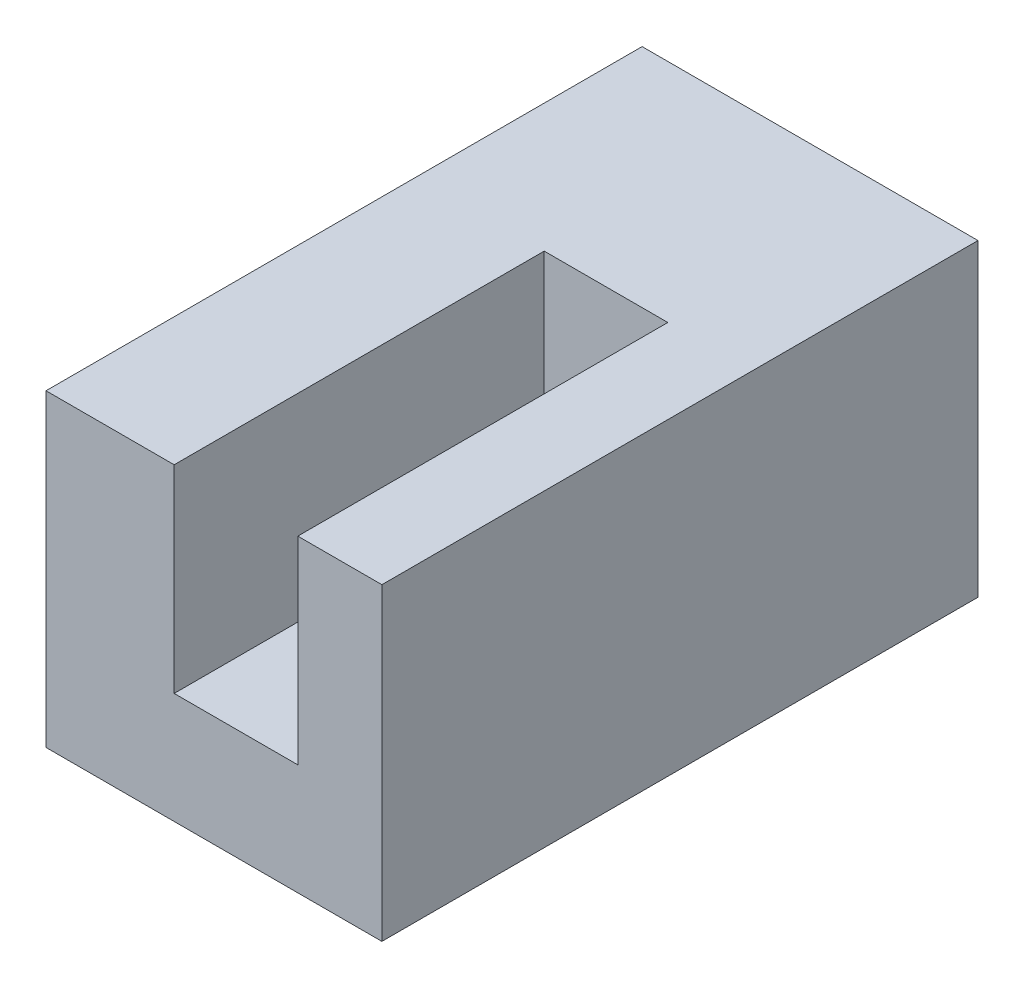
from build123d import *

# Parameters (mm, degrees)
SCHIZZO1_W                   = 3994
SCHIZZO1_H                   = 3673.5
ESTRUSIONE_ESTRUSIONE1_DEPTH = 7088
SCHIZZO2_W                   = 1470
SCHIZZO2_H                   = 2355
TAGLIO_ESTRUSIONE1_DEPTH     = 4400


with BuildPart() as part:
    # Schizzo1 → Estrusione-Estrusione1 (new body)
    with BuildSketch(Plane.XY):
        with Locations((1997, 1836.75)):
            Rectangle(SCHIZZO1_W, SCHIZZO1_H)
    extrude(amount=-ESTRUSIONE_ESTRUSIONE1_DEPTH)

    # Schizzo2 → Taglio-Estrusione1 (cut)
    with BuildSketch(Plane.XY):
        with Locations((2259, 2496)):
            Rectangle(SCHIZZO2_W, SCHIZZO2_H)
    extrude(amount=-TAGLIO_ESTRUSIONE1_DEPTH, mode=Mode.SUBTRACT)


solid = part.part
